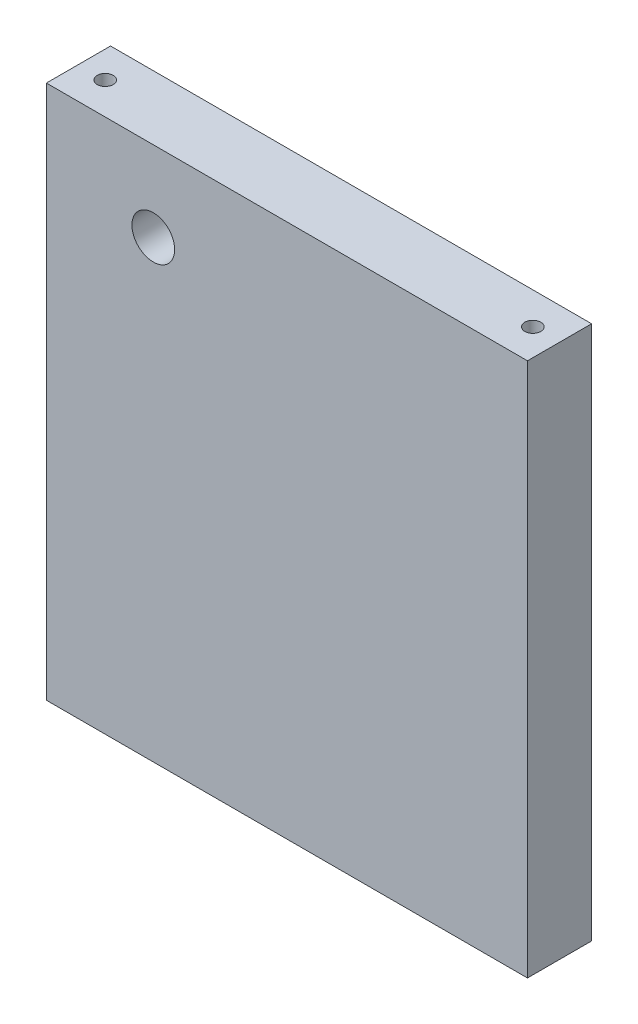
from build123d import *

# Parameters (mm, degrees)
SKETCH1_W           = 90
SKETCH1_H           = 100
BOSS_EXTRUDE1_DEPTH = 12
CUT_EXTRUDE4_DEPTH  = 3
LPATTERN1_DEPTH     = 7
SKETCH1_6_R         = 4
CUT_EXTRUDE6_DEPTH  = 121.244349775
SKETCH3_R           = 1.5
CUT_EXTRUDE5_DEPTH  = 145.008145785


# Read off the part's stored shape, not the designer's step: LPattern1
with BuildPart() as part:
    # Sketch1 → Boss-Extrude1 (new body)
    with BuildSketch(Plane.XY):
        with Locations((-57.928839751, 10.994734202)):
            Rectangle(SKETCH1_W, SKETCH1_H)
    extrude(amount=BOSS_EXTRUDE1_DEPTH)

    # Sketch1<5> → Cut-Extrude4 (cut)
    with BuildSketch(Plane.XY):
        with BuildLine():
            Line((-44.928839751, -25.562781554), (-44.928839751, 37.591400024))
            Line((-44.928839751, 37.591400024), (-70.928839751, 11.591400024))
            Line((-70.928839751, 11.591400024), (-70.928839751, -28.377423907))
            Line((-70.928839751, -28.377423907), (-70.928839751, -36.005265798))
            Line((-70.928839751, -36.005265798), (-54.128683309, -36.005265798))
            Line((-54.128683309, -36.005265798), (-45.807519408, -27.684101897))
            ThreePointArc((-45.807519408, -27.684101897), (-45.157201154, -26.710831851), (-44.928839751, -25.562781554))
        make_face()
        Polygon((-50.928839751, 23.10611865), (-50.928839751, -21.987520776), (-56.463060705, -21.011688304), (-64.928839751, -24.092979887), (-64.928839751, 9.10611865), align=None, mode=Mode.SUBTRACT)
    extrude(amount=CUT_EXTRUDE4_DEPTH, mode=Mode.SUBTRACT)

    # LPattern1 outline → LPattern1 (cut)
    with BuildSketch(Plane.XY):
        with BuildLine():
            ThreePointArc((-45.807519408, -17.684101897), (-45.157201154, -16.710831851), (-44.928839751, -15.562781554))
            Line((-44.928839751, -15.562781554), (-44.928839751, 47.591400024))
            Line((-44.928839751, 47.591400024), (-70.928839751, 21.591400024))
            Line((-70.928839751, 21.591400024), (-70.928839751, -26.005265798))
            Line((-70.928839751, -26.005265798), (-54.128683309, -26.005265798))
            Line((-54.128683309, -26.005265798), (-45.807519408, -17.684101897))
        make_face()
        Polygon((-64.928839751, 19.10611865), (-50.928839751, 33.10611865), (-50.928839751, -11.987520776), (-56.463060705, -11.011688304), (-64.928839751, -14.092979887), align=None, mode=Mode.SUBTRACT)
    extrude(amount=LPATTERN1_DEPTH, mode=Mode.SUBTRACT)

    # Sketch1<6> → Cut-Extrude6 (cut, through all)
    with BuildSketch(Plane.XY):
        with Locations((-82.928839751, 45.994734202)):
            Circle(SKETCH1_6_R)
    extrude(amount=CUT_EXTRUDE6_DEPTH, mode=Mode.SUBTRACT)

    # Sketch3 → Cut-Extrude5 (cut, through all)
    with BuildSketch(Plane(origin=(0, 60.994734202, 0), x_dir=(1, 0, 0), z_dir=(0, 1, 0))):
        with Locations(Location((-17.928839751, -6, 0), (0, 0, 270))):
            Circle(SKETCH3_R)
        with Locations(Location((-97.928839751, -6, 0), (0, 0, 270))):
            Circle(SKETCH3_R)
    extrude(amount=-CUT_EXTRUDE5_DEPTH, mode=Mode.SUBTRACT)


solid = part.part
